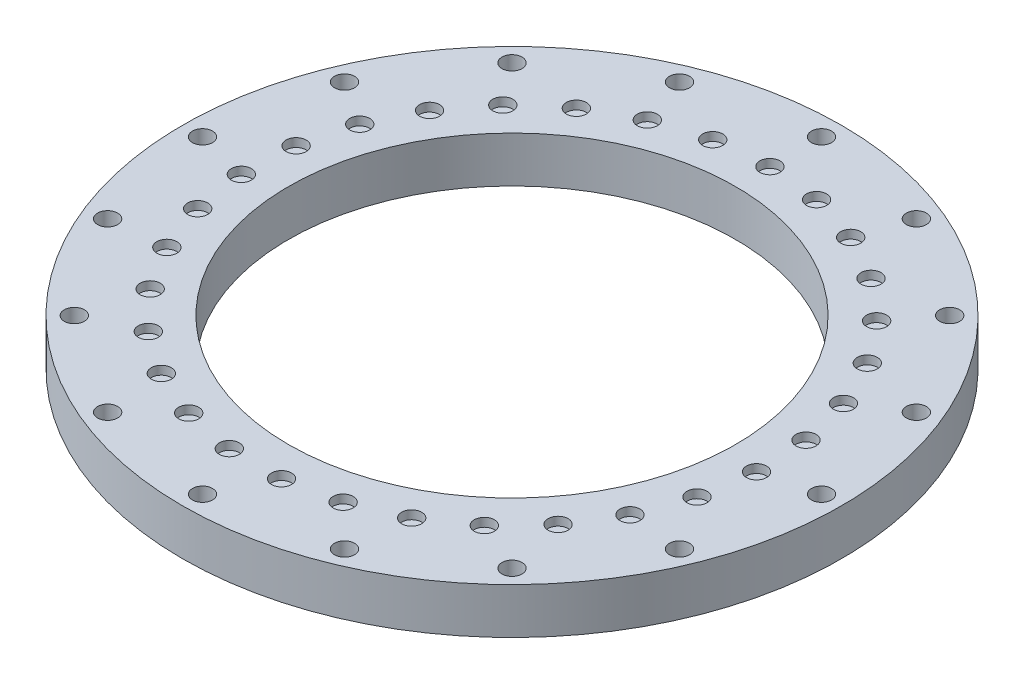
from build123d import *

# Parameters (mm, degrees)
SKETCH1_R           = 57.5
SKETCH1_R_2         = 39
BOSS_EXTRUDE1_DEPTH = 8
SKETCH2_R           = 1.75
CUT_EXTRUDE1_DEPTH  = 17
SKETCH3_R           = 1.75
CUT_EXTRUDE2_DEPTH  = 1.5
SKETCH5_R           = 2
CUT_EXTRUDE3_DEPTH  = 5


with BuildPart() as part:
    # Sketch1 → Boss-Extrude1 (new body)
    with BuildSketch(Plane(origin=(0, 0, 0), x_dir=(1, 0, 0), z_dir=(0, 1, 0))):
        Circle(SKETCH1_R)
        Circle(SKETCH1_R_2, mode=Mode.SUBTRACT)
    extrude(amount=BOSS_EXTRUDE1_DEPTH)

    # Sketch2 → Cut-Extrude1 (cut)
    with BuildSketch(Plane(origin=(0, 8, 0), x_dir=(1, 0, 0), z_dir=(0, 1, 0))):
        with Locations((0, 54)):
            Circle(SKETCH2_R)
        with Locations((20.664905348, 49.889494756)):
            Circle(SKETCH2_R)
        with Locations((38.183766184, 38.183766184)):
            Circle(SKETCH2_R)
        with Locations((49.889494756, 20.664905348)):
            Circle(SKETCH2_R)
        with Locations((54, 0)):
            Circle(SKETCH2_R)
        with Locations((49.889494756, -20.664905348)):
            Circle(SKETCH2_R)
        with Locations((38.183766184, -38.183766184)):
            Circle(SKETCH2_R)
        with Locations((20.664905348, -49.889494756)):
            Circle(SKETCH2_R)
        with Locations((0, -54)):
            Circle(SKETCH2_R)
        with Locations((-20.664905348, -49.889494756)):
            Circle(SKETCH2_R)
        with Locations((-38.183766184, -38.183766184)):
            Circle(SKETCH2_R)
        with Locations((-49.889494756, -20.664905348)):
            Circle(SKETCH2_R)
        with Locations((-54, 0)):
            Circle(SKETCH2_R)
        with Locations((-49.889494756, 20.664905348)):
            Circle(SKETCH2_R)
        with Locations((-38.183766184, 38.183766184)):
            Circle(SKETCH2_R)
        with Locations((-20.664905348, 49.889494756)):
            Circle(SKETCH2_R)
    extrude(amount=-CUT_EXTRUDE1_DEPTH, mode=Mode.SUBTRACT)

    # Sketch3 → Cut-Extrude2 (cut)
    with BuildSketch(Plane(origin=(0, 8, 0), x_dir=(1, 0, 0), z_dir=(0, 1, 0))):
        with Locations((0, 45)):
            Circle(SKETCH3_R)
        with Locations((9.058433404, 44.078847356)):
            Circle(SKETCH3_R)
        with Locations((17.74601348, 41.353101523)):
            Circle(SKETCH3_R)
        with Locations((25.707069679, 36.934354854)):
            Circle(SKETCH3_R)
        with Locations((32.615675425, 31.003511358)):
            Circle(SKETCH3_R)
        with Locations((38.188991587, 23.803380465)):
            Circle(SKETCH3_R)
        with Locations((42.198845947, 15.628736378)):
            Circle(SKETCH3_R)
        with Locations((44.481074595, 6.814249988)):
            Circle(SKETCH3_R)
        with Locations((44.942242823, -2.279212598)):
            Circle(SKETCH3_R)
        with Locations((43.563470349, -11.279363952)):
            Circle(SKETCH3_R)
        with Locations((40.401204281, -19.81773682)):
            Circle(SKETCH3_R)
        with Locations((35.584908162, -27.544769215)):
            Circle(SKETCH3_R)
        with Locations((29.311761723, -34.144115521)):
            Circle(SKETCH3_R)
        with Locations((21.838588314, -39.345597727)):
            Circle(SKETCH3_R)
        with Locations((13.471340534, -42.936266538)):
            Circle(SKETCH3_R)
        with Locations((4.552574489, -44.769119553)):
            Circle(SKETCH3_R)
        with Locations((-4.552574489, -44.769119553)):
            Circle(SKETCH3_R)
        with Locations((-13.471340534, -42.936266538)):
            Circle(SKETCH3_R)
        with Locations((-21.838588314, -39.345597727)):
            Circle(SKETCH3_R)
        with Locations((-29.311761722, -34.144115521)):
            Circle(SKETCH3_R)
        with Locations((-35.584908162, -27.544769215)):
            Circle(SKETCH3_R)
        with Locations((-40.401204281, -19.81773682)):
            Circle(SKETCH3_R)
        with Locations((-43.563470349, -11.279363952)):
            Circle(SKETCH3_R)
        with Locations((-44.942242823, -2.279212598)):
            Circle(SKETCH3_R)
        with Locations((-44.481074595, 6.814249988)):
            Circle(SKETCH3_R)
        with Locations((-42.198845947, 15.628736378)):
            Circle(SKETCH3_R)
        with Locations((-38.188991587, 23.803380465)):
            Circle(SKETCH3_R)
        with Locations((-32.615675425, 31.003511358)):
            Circle(SKETCH3_R)
        with Locations((-25.707069679, 36.934354854)):
            Circle(SKETCH3_R)
        with Locations((-17.74601348, 41.353101523)):
            Circle(SKETCH3_R)
        with Locations((-9.058433404, 44.078847356)):
            Circle(SKETCH3_R)
    extrude(amount=-CUT_EXTRUDE2_DEPTH, mode=Mode.SUBTRACT)

    # Sketch5 → Cut-Extrude3 (cut)
    with BuildSketch(Plane.XZ):
        with Locations((0, 45)):
            Circle(SKETCH5_R)
        with Locations((38.97114317, -22.5)):
            Circle(SKETCH5_R)
        with Locations((-38.97114317, -22.5)):
            Circle(SKETCH5_R)
    extrude(amount=-CUT_EXTRUDE3_DEPTH, mode=Mode.SUBTRACT)


solid = part.part
